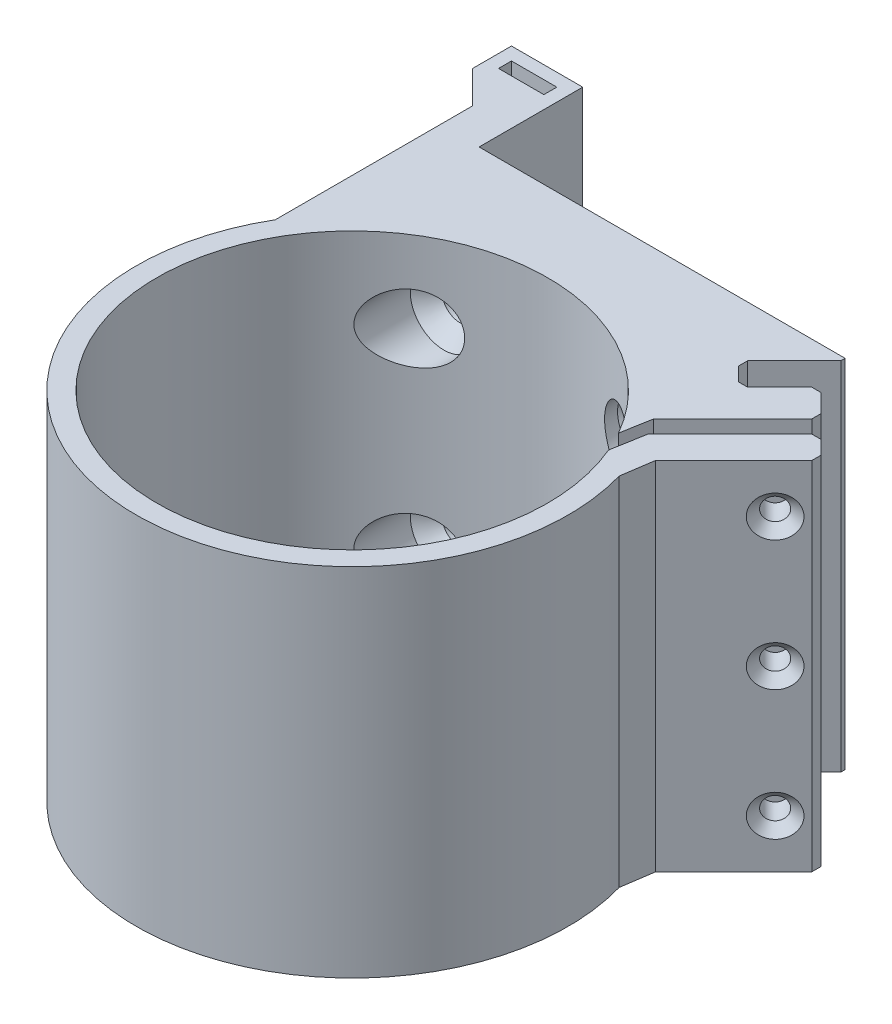
from build123d import *

# Parameters (mm, degrees)
SKETCH1_W                                       = 7
SKETCH1_H                                       = 2
BOSS_EXTRUDE1_DEPTH                             = 27.5
CSK_FOR_M3_FLAT_HEAD_MACHINE_SCREW1_D           = 3.4
CSK_FOR_M3_FLAT_HEAD_MACHINE_SCREW1_DEPTH       = 19.9898
CSK_FOR_M3_FLAT_HEAD_MACHINE_SCREW1_CSINK_D     = 6.3
CSK_FOR_M3_FLAT_HEAD_MACHINE_SCREW1_CSINK_ANGLE = 90
CSK_FOR_M3_FLAT_HEAD_MACHINE_SCREW1_TIP         = 1.021463052
SKETCH4_W                                       = 45.5
SKETCH4_H                                       = 6
BOSS_EXTRUDE2_DEPTH                             = 4.5
CSK_FOR_M5_FLAT_HEAD_MACHINE_SCREW1_AT_2_COUNT  = 2
CSK_FOR_M5_FLAT_HEAD_MACHINE_SCREW1_AT_2_PITCH  = 32
CSK_FOR_M5_FLAT_HEAD_MACHINE_SCREW1_AT_3_COUNT  = 2
CSK_FOR_M5_FLAT_HEAD_MACHINE_SCREW1_AT_3_PITCH  = 43.863424399
CSK_FOR_M5_FLAT_HEAD_MACHINE_SCREW1_AT_4_COUNT  = 2
CSK_FOR_M5_FLAT_HEAD_MACHINE_SCREW1_AT_4_PITCH  = 30
CUT_EXTRUDE1_REACH                              = 84.846
CUT_EXTRUDE1_END_RADIUS                         = 30.1625
SKETCH13_R                                      = 5.2
CHAMFER1_SIZE                                   = 1
CHAMFER2_SIZE                                   = 2.517275241


with BuildPart() as part:
    # Sketch1 → Boss-Extrude1 (new, symmetric)
    with BuildSketch(Plane(origin=(0, 0, 0), x_dir=(1, 0, 0), z_dir=(0, 1, 0))):
        with BuildLine():
            Line((-28.75, 16.87680083), (-28.75, 47.337500038))
            Line((-28.75, 47.337500038), (-33.75, 52.337500038))
            Line((-33.75, 52.337500038), (-33.75, 58.337500038))
            Line((-33.75, 58.337500038), (-22.75, 58.337500038))
            Line((-22.75, 58.337500038), (-22.75, 36.3375))
            Line((-22.75, 36.3375), (22.75, 36.3375))
            Line((22.75, 36.3375), (22.75, 42.3375))
            Line((22.75, 42.3375), (33.75, 42.3375))
            Line((33.75, 42.3375), (33.75, 41.680645751))
            Line((33.75, 41.680645751), (25.850505063, 33.781150814))
            Line((25.850505063, 33.781150814), (29.386038969, 30.245616908))
            Line((29.386038969, 30.245616908), (35.75, 36.609577939))
            Line((35.75, 36.609577939), (39.992640687, 32.366937252))
            Line((39.992640687, 32.366937252), (27.075624874, 19.449921438))
            Line((27.075624874, 19.449921438), (26.261945555, 14.835316711))
            ThreePointArc((26.261945555, 14.835316711), (-27.052466926, -13.339431752), (27.757868174, 11.801574499))
            Line((27.757868174, 11.801574499), (28.675140267, 17.00368304))
            Line((28.675140267, 17.00368304), (42.015517583, 30.344060356))
            Line((42.015517583, 30.344060356), (45.551051488, 26.80852645))
            Line((45.551051488, 26.80852645), (31.001655302, 12.259130263))
            ThreePointArc((31.001655302, 12.259130263), (-2.568697776, -33.238391928), (-28.75, 16.87680083))
        make_face()
        with Locations((-28.25, 55.337500038)):
            Rectangle(SKETCH1_W, SKETCH1_H, mode=Mode.SUBTRACT)
    extrude(amount=BOSS_EXTRUDE1_DEPTH, both=True)

    # CSK for M3 Flat Head Machine Screw1
    with Locations(Plane(origin=(9.371262519, 0, 9.371262519), x_dir=(0.7071067811865392, 0, -0.7071067811865558), z_dir=(0.7071067811865558, 0, 0.7071067811865392))):
        with Locations((46.165948244, 20), (46.165948244, 0), (46.165948244, -20)):
            CounterSinkHole(CSK_FOR_M3_FLAT_HEAD_MACHINE_SCREW1_D / 2, CSK_FOR_M3_FLAT_HEAD_MACHINE_SCREW1_CSINK_D / 2, depth=CSK_FOR_M3_FLAT_HEAD_MACHINE_SCREW1_DEPTH, counter_sink_angle=CSK_FOR_M3_FLAT_HEAD_MACHINE_SCREW1_CSINK_ANGLE)
            with Locations((0, 0, -(CSK_FOR_M3_FLAT_HEAD_MACHINE_SCREW1_DEPTH + CSK_FOR_M3_FLAT_HEAD_MACHINE_SCREW1_TIP / 2))):  # 118° drill point
                Cone(0, CSK_FOR_M3_FLAT_HEAD_MACHINE_SCREW1_D / 2, CSK_FOR_M3_FLAT_HEAD_MACHINE_SCREW1_TIP, mode=Mode.SUBTRACT)

    # Sketch4 → Boss-Extrude2 (add)
    with BuildSketch(Plane.XZ.offset(-27.5)):
        with Locations((0, -39.3375)):
            Rectangle(SKETCH4_W, SKETCH4_H)
    extrude(amount=BOSS_EXTRUDE2_DEPTH)

    # Sketch12 → CSK for M5 Flat Head Machine Screw1 (revolve, cut)
    with BuildSketch(Plane(origin=(-16, 15, -30.1625), x_dir=(0, -1, 0), z_dir=(1, 0, 0))):
        Polygon((0, 0), (0, 28.175000038), (2.75, 28.175000038), (2.75, 2.45), (5.2, 0), align=None)
    csk_for_m5_flat_head_machine_screw1 = revolve(axis=Axis((-16, 15, -23.8125), (0, 0, -1)), mode=Mode.SUBTRACT)

    # CSK for M5 Flat Head Machine Screw1 at 2: CSK for M5 Flat Head Machine Screw1 ×2
    with Locations(*[(i * CSK_FOR_M5_FLAT_HEAD_MACHINE_SCREW1_AT_2_PITCH, 0, 0) for i in range(1, CSK_FOR_M5_FLAT_HEAD_MACHINE_SCREW1_AT_2_COUNT)]):
        add(csk_for_m5_flat_head_machine_screw1, mode=Mode.SUBTRACT)

    # CSK for M5 Flat Head Machine Screw1 at 3: CSK for M5 Flat Head Machine Screw1 ×2
    with Locations(*[Vector(0.7295372041400853, -0.6839411288813297, 0) * (i * CSK_FOR_M5_FLAT_HEAD_MACHINE_SCREW1_AT_3_PITCH) for i in range(1, CSK_FOR_M5_FLAT_HEAD_MACHINE_SCREW1_AT_3_COUNT)]):
        add(csk_for_m5_flat_head_machine_screw1, mode=Mode.SUBTRACT)

    # CSK for M5 Flat Head Machine Screw1 at 4: CSK for M5 Flat Head Machine Screw1 ×2
    with Locations(*[(0, -i * CSK_FOR_M5_FLAT_HEAD_MACHINE_SCREW1_AT_4_PITCH, 0) for i in range(1, CSK_FOR_M5_FLAT_HEAD_MACHINE_SCREW1_AT_4_COUNT)]):
        add(csk_for_m5_flat_head_machine_screw1, mode=Mode.SUBTRACT)

    # Cut-Extrude1: up to this cylinder (the profile starts outside it)
    cut_extrude1_end = Plane(origin=(0, 0, 0), z_dir=(0, -1, 0)) * Cylinder(CUT_EXTRUDE1_END_RADIUS, 261.017, mode=Mode.PRIVATE)
    # Sketch13 → Cut-Extrude1 (cut, up to the surface)
    with BuildSketch(Plane.XY.offset(-30.1625), mode=Mode.PRIVATE) as cut_extrude1_sk1:
        with Locations(Location((-16, -15, 0), (0, 0, 180))):
            Circle(SKETCH13_R)
    cut_extrude1_tool1 = extrude(cut_extrude1_sk1.sketch, amount=CUT_EXTRUDE1_REACH, mode=Mode.PRIVATE) - cut_extrude1_end
    add(cut_extrude1_tool1.solids().sort_by_distance((-16, -15, -30.1625))[0], mode=Mode.SUBTRACT)
    # Sketch13 → Cut-Extrude1 (cut, up to the surface)
    with BuildSketch(Plane.XY.offset(-30.1625), mode=Mode.PRIVATE) as cut_extrude1_sk2:
        with Locations(Location((16, -15, 0), (0, 0, 180))):
            Circle(SKETCH13_R)
    cut_extrude1_tool2 = extrude(cut_extrude1_sk2.sketch, amount=CUT_EXTRUDE1_REACH, mode=Mode.PRIVATE) - cut_extrude1_end
    add(cut_extrude1_tool2.solids().sort_by_distance((16, -15, -30.1625))[0], mode=Mode.SUBTRACT)
    # Sketch13 → Cut-Extrude1 (cut, up to the surface)
    with BuildSketch(Plane.XY.offset(-30.1625), mode=Mode.PRIVATE) as cut_extrude1_sk3:
        with Locations(Location((16, 15, 0), (0, 0, 180))):
            Circle(SKETCH13_R)
    cut_extrude1_tool3 = extrude(cut_extrude1_sk3.sketch, amount=CUT_EXTRUDE1_REACH, mode=Mode.PRIVATE) - cut_extrude1_end
    add(cut_extrude1_tool3.solids().sort_by_distance((16, 15, -30.1625))[0], mode=Mode.SUBTRACT)
    # Sketch13 → Cut-Extrude1 (cut, up to the surface)
    with BuildSketch(Plane.XY.offset(-30.1625), mode=Mode.PRIVATE) as cut_extrude1_sk4:
        with Locations(Location((-16, 15, 0), (0, 0, 180))):
            Circle(SKETCH13_R)
    cut_extrude1_tool4 = extrude(cut_extrude1_sk4.sketch, amount=CUT_EXTRUDE1_REACH, mode=Mode.PRIVATE) - cut_extrude1_end
    add(cut_extrude1_tool4.solids().sort_by_distance((-16, 15, -30.1625))[0], mode=Mode.SUBTRACT)

    # Chamfer1
    chamfer1_edges = [part.edges().sort_by_distance(p)[0] for p in [
        (42.015517583, 0, -30.344060356),
        (45.551051488, 0, -26.80852645),
        (25.850505063, 0, -33.781150814),
        (29.386038969, 0, -30.245616908),
        (35.75, 0, -36.609577939),
        (39.992640687, 0, -32.366937252),
    ]]
    chamfer(chamfer1_edges, length=CHAMFER1_SIZE)

    # Chamfer2
    # the kernel refuses this chamfer: 3, 2.517275241 mm, written as the material it adds along each edge
    with BuildSketch(Plane(origin=(31.001655302, -27.5, -12.259130263), x_dir=(0.3214763469276341, 0, 0.9469176090695871), z_dir=(0, 1, 0))) as chamfer2_piece_1:
        with BuildLine():
            Line((3.284174846, 0), (-CHAMFER2_SIZE * 0.442253757678, CHAMFER2_SIZE * 0.896889967468))
            Line((-CHAMFER2_SIZE * 0.442253757678, CHAMFER2_SIZE * 0.896889967468), (0, 0))
            ThreePointArc((0, 0), (1.695572388, 0.040423367), (3.284174846, 0))
        make_face()
    extrude(amount=55)


solid = part.part
